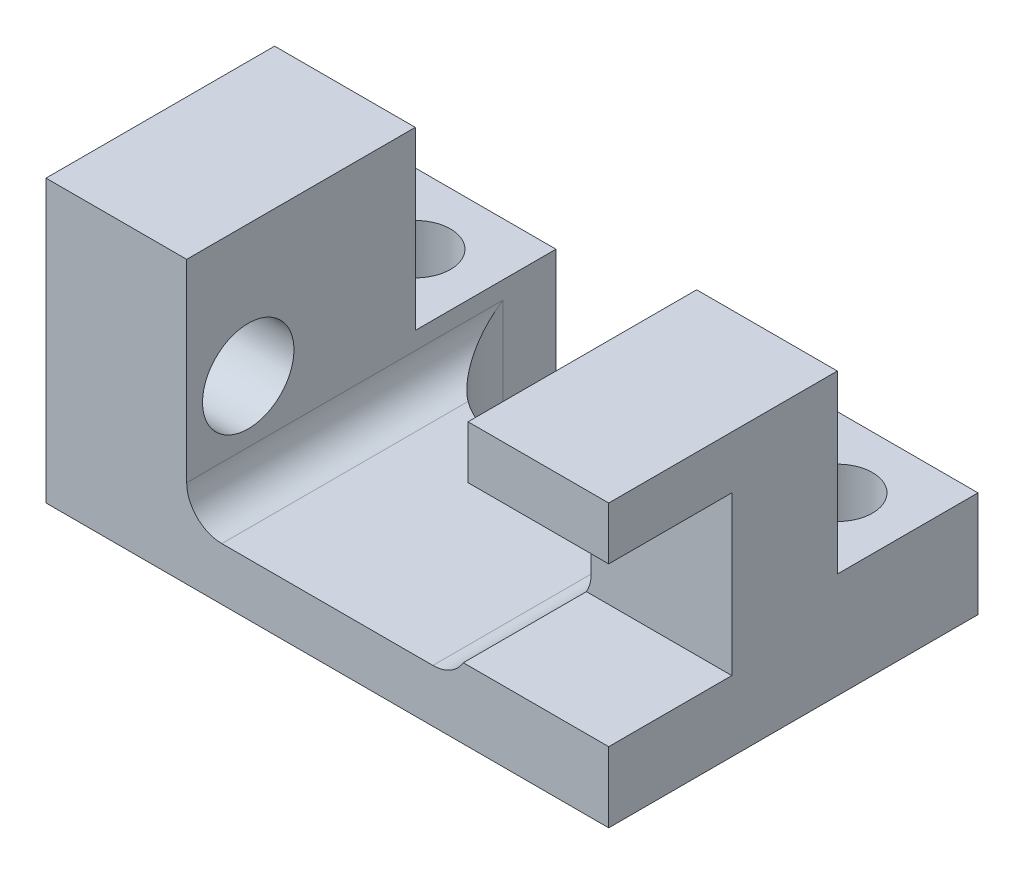
from build123d import *

# Parameters (mm, degrees)
SKETCH1_W                  = 16
SKETCH1_H                  = 6.5
BOSS_EXTRUDE1_DEPTH        = 4
SKETCH2_W                  = 8
SKETCH2_H                  = 6.5
CUT_EXTRUDE1_DEPTH         = 6.5
SKETCH10_W                 = 4
SKETCH10_H                 = 4
BOSS_EXTRUDE2_DEPTH        = 3
M1_6_CLEARANCE_HOLE1_D     = 2
M1_6_CLEARANCE_HOLE1_DEPTH = 4
M1_6_CLEARANCE_HOLE1_TIP   = 0.600860619
FILLET1_R                  = 1
FILLET2_R                  = 2.5
SKETCH14_W                 = 3.5
SKETCH14_H                 = 4.5
CUT_EXTRUDE3_DEPTH         = 5
M2_CLEARANCE_HOLE3_D       = 2.6
M2_CLEARANCE_HOLE3_DEPTH   = 4
M2_CLEARANCE_HOLE3_TIP     = 0.781118805


with BuildPart() as part:
    # Sketch1 → Boss-Extrude1 (new, symmetric)
    with BuildSketch(Plane(origin=(0, 0, 0), x_dir=(1, 0, 0), z_dir=(0, 1, 0))):
        Rectangle(SKETCH1_W, SKETCH1_H)
    extrude(amount=BOSS_EXTRUDE1_DEPTH, both=True)

    # Sketch2 → Cut-Extrude1 (cut)
    with BuildSketch(Plane(origin=(0, 4, 5), x_dir=(1, 0, 0), z_dir=(0, -1, 0))):
        with Locations((0, -5)):
            Rectangle(SKETCH2_W, SKETCH2_H)
    extrude(amount=CUT_EXTRUDE1_DEPTH, mode=Mode.SUBTRACT)

    # Sketch10 → Boss-Extrude2 (add)
    with BuildSketch(Plane.XZ.offset(4)):
        with Locations((6, -5.25)):
            Rectangle(SKETCH10_W, SKETCH10_H)
        with Locations((-6, -5.25)):
            Rectangle(SKETCH10_W, SKETCH10_H)
    extrude(amount=-BOSS_EXTRUDE2_DEPTH)

    # M1.6 Clearance Hole1
    with Locations(Plane(origin=(0, -1, 0), x_dir=(1, 0, 0), z_dir=(0, 1, 0))):
        with Locations((6, 5.25), (-6, 5.25)):
            Hole(M1_6_CLEARANCE_HOLE1_D / 2, depth=M1_6_CLEARANCE_HOLE1_DEPTH)
            with Locations((0, 0, -(M1_6_CLEARANCE_HOLE1_DEPTH + M1_6_CLEARANCE_HOLE1_TIP / 2))):  # 118° drill point
                Cone(0, M1_6_CLEARANCE_HOLE1_D / 2, M1_6_CLEARANCE_HOLE1_TIP, mode=Mode.SUBTRACT)

    # Fillet1
    fillet1_edges = [part.edges().sort_by_distance(p)[0] for p in [
        (-4, -2.5, 0),
        (4, -2.5, 0),
    ]]
    fillet(fillet1_edges, radius=FILLET1_R)

    # Fillet2
    fillet2_edges = [part.edges().sort_by_distance(p)[0] for p in [
        (-4, -2.75, -3.25),
        (4, -2.75, -3.25),
    ]]
    fillet(fillet2_edges, radius=FILLET2_R)

    # Sketch14 → Cut-Extrude3 (cut)
    with BuildSketch(Plane(origin=(8, 0, 0), x_dir=(0, 0, -1), z_dir=(1, 0, 0))):
        with Locations((-1.5, 0.25)):
            Rectangle(SKETCH14_W, SKETCH14_H)
    extrude(amount=-CUT_EXTRUDE3_DEPTH, mode=Mode.SUBTRACT)

    # M2 Clearance Hole3
    with Locations(Plane.ZY.offset(8)):
        with Locations((1.5, 0.25)):
            Hole(M2_CLEARANCE_HOLE3_D / 2, depth=M2_CLEARANCE_HOLE3_DEPTH)
            with Locations((0, 0, -(M2_CLEARANCE_HOLE3_DEPTH + M2_CLEARANCE_HOLE3_TIP / 2))):  # 118° drill point
                Cone(0, M2_CLEARANCE_HOLE3_D / 2, M2_CLEARANCE_HOLE3_TIP, mode=Mode.SUBTRACT)


solid = part.part
